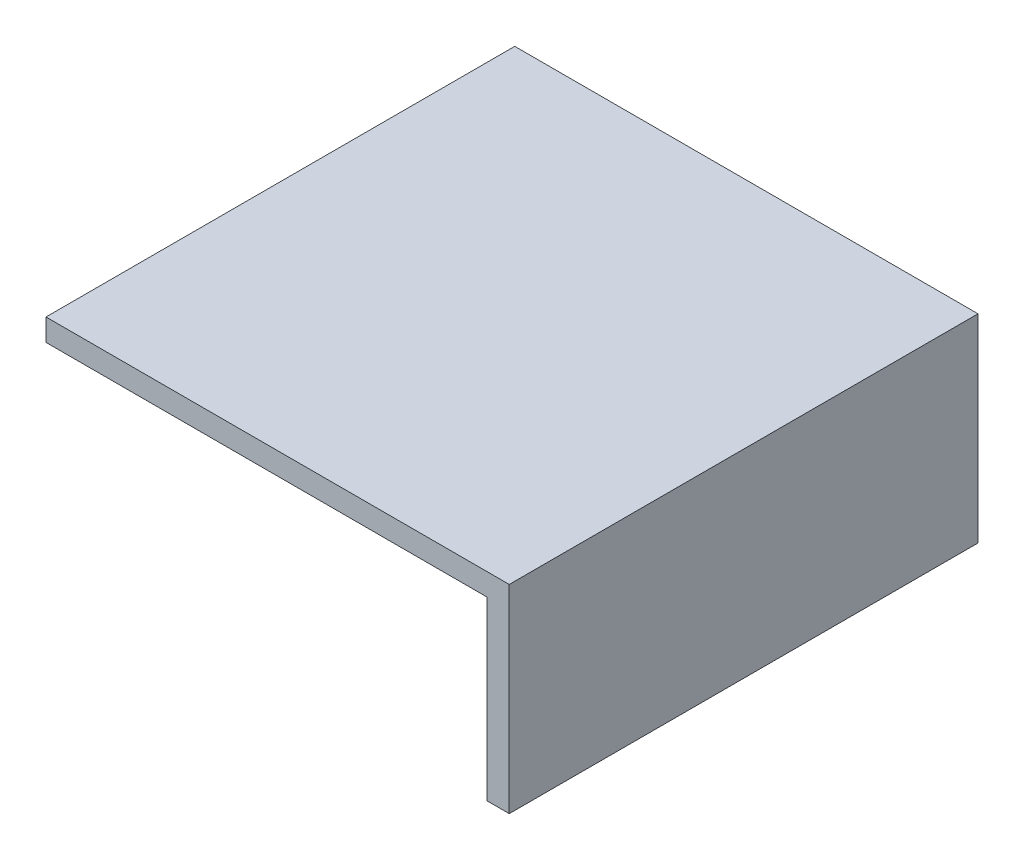
from build123d import *

# Parameters (mm, degrees)
BOSS_EXTRUDE1_DEPTH      = 21.25
BOSS_EXTRUDE1_DEPTH_BACK = 21.25


with BuildPart() as part:
    # Sketch1 → Boss-Extrude1 (new, two sides: drawn at the far end of the back side and taken through both)
    with BuildSketch(Plane.XY.offset(-BOSS_EXTRUDE1_DEPTH_BACK)):
        Polygon((21, 1), (21, -17), (19, -17), (19, -1), (-21, -1), (-21, 1), align=None)
    extrude(amount=BOSS_EXTRUDE1_DEPTH + BOSS_EXTRUDE1_DEPTH_BACK)


solid = part.part
